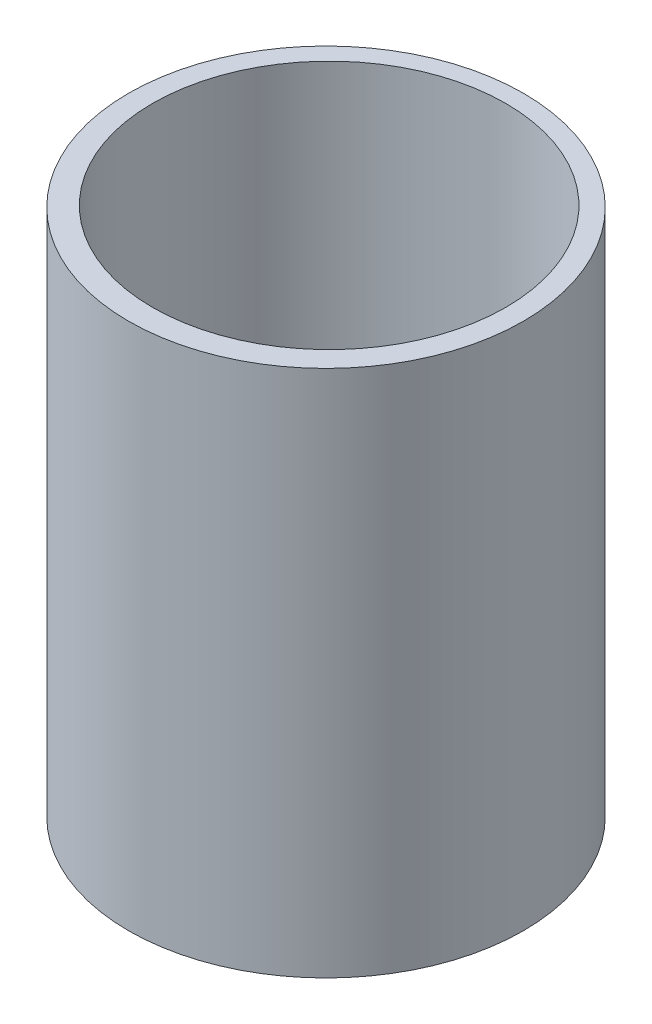
from build123d import *

# Parameters (mm, degrees)
PVC_R               = 57
PVC_R_2             = 51
BOSS_EXTRUDE1_DEPTH = 152.4


with BuildPart() as part:
    # PVC → Boss-Extrude1 (new body)
    with BuildSketch(Plane(origin=(0, 0, 0), x_dir=(1, 0, 0), z_dir=(0, 1, 0))):
        Circle(PVC_R)
        with Locations((0, 0.907913161)):
            Circle(PVC_R_2, mode=Mode.SUBTRACT)
    extrude(amount=BOSS_EXTRUDE1_DEPTH)


solid = part.part
